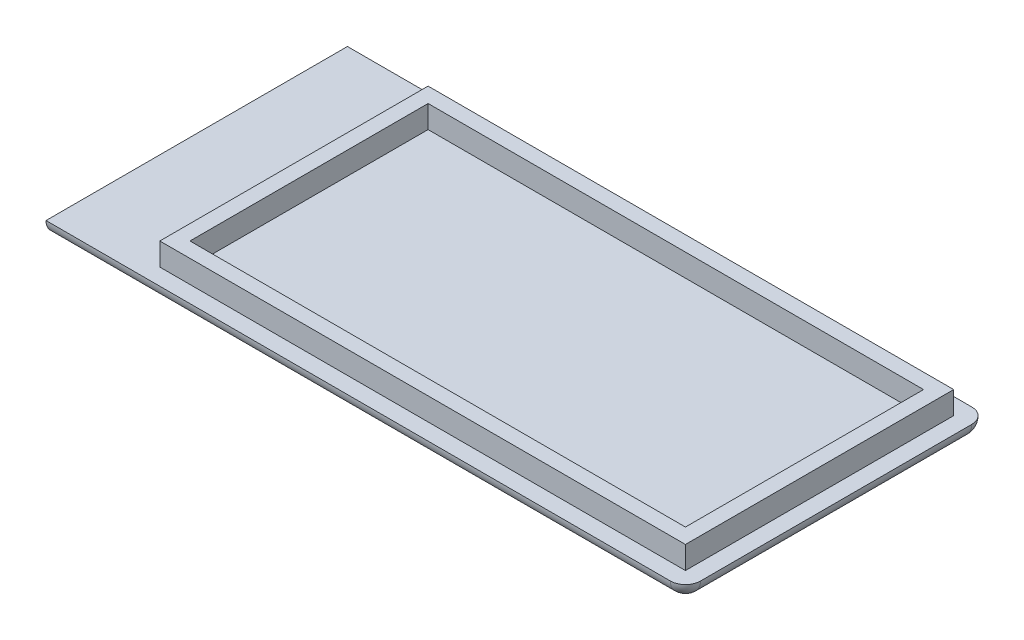
from build123d import *

# Parameters (mm, degrees)
SKETCH1_W           = 42.42562
SKETCH1_H           = 1
BOSS_EXTRUDE1_DEPTH = 19.99996
FILLET1_R           = 1
SKETCH2_W           = 34.8742
SKETCH2_H           = 17.79996
SKETCH2_W_2         = 32.8742
SKETCH2_H_2         = 15.79996
BOSS_EXTRUDE2_DEPTH = 1.5


with BuildPart() as part:
    # Sketch1 → Boss-Extrude1 (new body)
    with BuildSketch(Plane.XY):
        with Locations((21.21281, 0.5)):
            Rectangle(SKETCH1_W, SKETCH1_H)
    extrude(amount=BOSS_EXTRUDE1_DEPTH)

    # Fillet1
    # the kernel refuses this fillet: 1 mm, written as the material it takes off along each edge
    with BuildSketch(Plane(origin=(41.42562, 1, 18.99996), x_dir=(1, 0, 0), z_dir=(0, -1, 0))) as fillet1_piece_1_section:
        Polygon((0, 0), (FILLET1_R * 1.02, 0), (FILLET1_R * 1.02, FILLET1_R * 1.02), (0, FILLET1_R * 1.02), align=None)
    fillet1_piece_1 = extrude(amount=FILLET1_R * 1.02, mode=Mode.PRIVATE)
    fillet1_piece_1 = fillet1_piece_1 - Plane(origin=(41.42562, 1, 18.99996), x_dir=(-0.7071067811865475, 0, -0.7071067811865475), z_dir=(0, -1, 0)) * Sphere(FILLET1_R, mode=Mode.PRIVATE)
    add(fillet1_piece_1, mode=Mode.SUBTRACT)
    with BuildSketch(Plane(origin=(41.42562, 1, 1), x_dir=(1, 0, 0), z_dir=(0, -1, 0))) as fillet1_piece_2_section:
        Polygon((0, 0), (FILLET1_R * 1.02, 0), (FILLET1_R * 1.02, -FILLET1_R * 1.02), (0, -FILLET1_R * 1.02), align=None)
    fillet1_piece_2 = extrude(amount=FILLET1_R * 1.02, mode=Mode.PRIVATE)
    fillet1_piece_2 = fillet1_piece_2 - Plane(origin=(41.42562, 1, 1), x_dir=(-0.7071067811865475, 0, 0.7071067811865475), z_dir=(0, -1, 0)) * Sphere(FILLET1_R, mode=Mode.PRIVATE)
    add(fillet1_piece_2, mode=Mode.SUBTRACT)
    with BuildSketch(Plane(origin=(-2.5, 0, 0), x_dir=(0, 0, 1), z_dir=(1, 0, 0))) as fillet1_piece_3:
        with BuildLine():
            CenterArc((FILLET1_R, -FILLET1_R), FILLET1_R, 90, 90)
            Line((0, -FILLET1_R), (0, 0))
            Line((0, 0), (FILLET1_R, 0))
        make_face()
    extrude(amount=43.92562, mode=Mode.SUBTRACT)
    with BuildSketch(Plane(origin=(-2.5, 0, 19.99996), x_dir=(0, 0, -1), z_dir=(1, 0, 0))) as fillet1_piece_4:
        with BuildLine():
            CenterArc((FILLET1_R, FILLET1_R), FILLET1_R, 180, 90)
            Line((0, FILLET1_R), (0, 0))
            Line((0, 0), (FILLET1_R, 0))
        make_face()
    extrude(amount=43.92562, mode=Mode.SUBTRACT)
    with BuildSketch(Plane(origin=(42.42562, 0, 1), x_dir=(-1, 0, 0), z_dir=(0, 0, 1))) as fillet1_piece_5:
        with BuildLine():
            CenterArc((FILLET1_R, -FILLET1_R), FILLET1_R, 90, 90)
            Line((0, -FILLET1_R), (0, 0))
            Line((0, 0), (FILLET1_R, 0))
        make_face()
    extrude(amount=17.99996, mode=Mode.SUBTRACT)

    # Sketch2 → Boss-Extrude2 (add)
    with BuildSketch(Plane(origin=(0, 1, 0), x_dir=(1, 0, 0), z_dir=(0, 1, 0))):
        with Locations((23.88852, -9.99998)):
            Rectangle(SKETCH2_W, SKETCH2_H)
        with Locations((23.88852, -9.99998)):
            Rectangle(SKETCH2_W_2, SKETCH2_H_2, mode=Mode.SUBTRACT)
    extrude(amount=BOSS_EXTRUDE2_DEPTH)


solid = part.part
